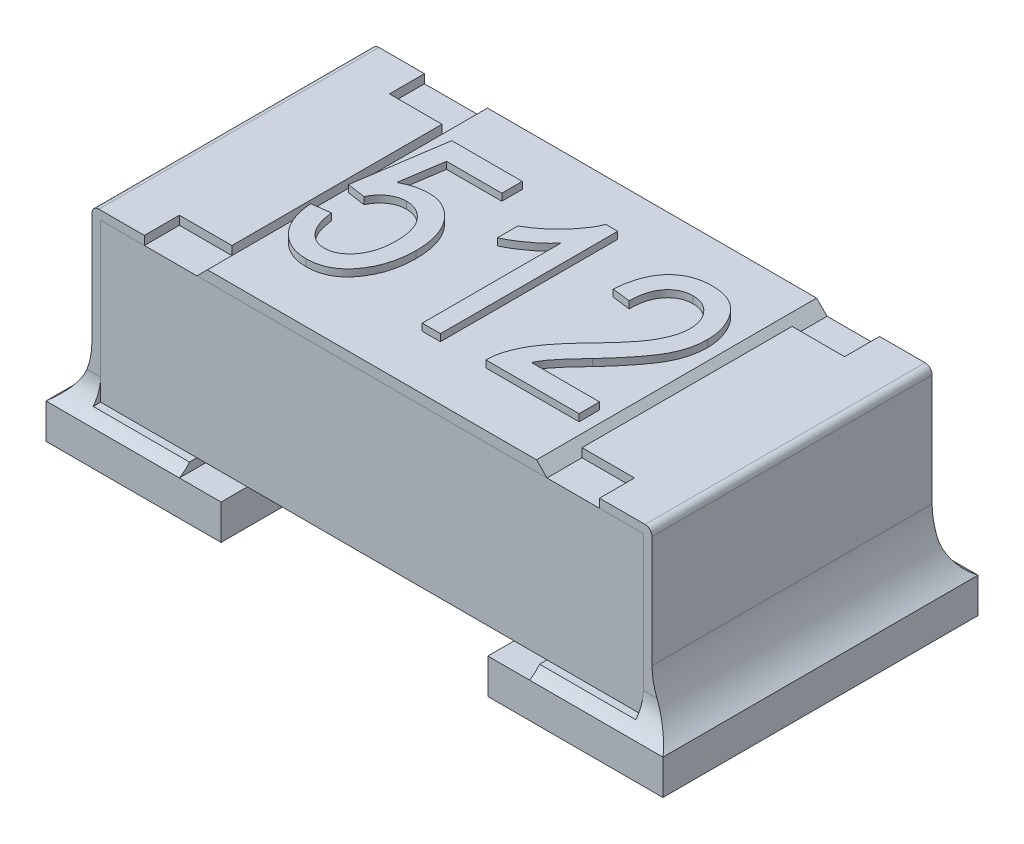
from build123d import *

# Parameters (mm, degrees)
SKETCH1_W             = 0.8
SKETCH1_H             = 0.45
BOSS_EXTRUDE1_DEPTH   = 0.775
BOSS_EXTRUDE2_DEPTH   = 0.4
BOSS_EXTRUDE2_2_DEPTH = 0.4
SKETCH3_W             = 0.15
SKETCH3_H             = 0.1
CUT_EXTRUDE1_DEPTH    = 0.025
BOSS_EXTRUDE3_DEPTH   = 0.4
SKETCH7_W             = 0.5
SKETCH7_H             = 0.9
BOSS_EXTRUDE5_DEPTH   = 0.1
FILLET3_R             = 0.2
FILLET4_R             = 0.2
FILLET5_R             = 0.1
FILLET6_R             = 0.1
BOSS_EXTRU_1_DEPTH    = 0.02


with BuildPart() as part:
    # Sketch1 → Boss-Extrude1 (new, symmetric)
    with BuildSketch(Plane(origin=(0, 0, 0), x_dir=(0, 0, -1), z_dir=(1, 0, 0))):
        with Locations((0, 0.35)):
            Rectangle(SKETCH1_W, SKETCH1_H)
    extrude(amount=BOSS_EXTRUDE1_DEPTH, both=True)


with BuildPart() as body_2:
    # Sketch2 → Boss-Extrude2 (new, symmetric)
    with BuildSketch(Plane.XY):
        with BuildLine():
            Line((-0.5, 0.6), (-0.78, 0.6))
            ThreePointArc((-0.78, 0.6), (-0.794142136, 0.594142136), (-0.8, 0.58))
            Line((-0.8, 0.58), (-0.8, 0.1))
            Line((-0.8, 0.1), (-0.5, 0.1))
            Line((-0.5, 0.1), (-0.5, 0.125))
            Line((-0.5, 0.125), (-0.775, 0.125))
            Line((-0.775, 0.125), (-0.775, 0.575))
            Line((-0.775, 0.575), (-0.5, 0.575))
            Line((-0.5, 0.575), (-0.5, 0.6))
        make_face()
    extrude(amount=BOSS_EXTRUDE2_DEPTH, both=True)


with BuildPart() as body_3:
    # Sketch2 → Boss-Extrude2 2 (new, symmetric)
    with BuildSketch(Plane.XY):
        with BuildLine():
            Line((0.5, 0.575), (0.5, 0.6))
            Line((0.5, 0.6), (0.78, 0.6))
            ThreePointArc((0.78, 0.6), (0.794142136, 0.594142136), (0.8, 0.58))
            Line((0.8, 0.58), (0.8, 0.1))
            Line((0.8, 0.1), (0.5, 0.1))
            Line((0.5, 0.1), (0.5, 0.125))
            Line((0.5, 0.125), (0.775, 0.125))
            Line((0.775, 0.125), (0.775, 0.575))
            Line((0.775, 0.575), (0.5, 0.575))
        make_face()
    extrude(amount=BOSS_EXTRUDE2_2_DEPTH, both=True)


with BuildPart() as cut_extrude1_tool:
    # Sketch3 → Cut-Extrude1 (new body)
    with BuildSketch(Plane(origin=(0, 0.6, 0), x_dir=(1, 0, 0), z_dir=(0, 1, 0))):
        with Locations((-0.575, 0.35)):
            Rectangle(SKETCH3_W, SKETCH3_H)
        with Locations((-0.575, -0.35)):
            Rectangle(SKETCH3_W, SKETCH3_H)
        with Locations((0.575, -0.35)):
            Rectangle(SKETCH3_W, SKETCH3_H)
        with Locations((0.575, 0.35)):
            Rectangle(SKETCH3_W, SKETCH3_H)
    extrude(amount=-CUT_EXTRUDE1_DEPTH)


with BuildPart() as body_2_1:
    add(body_2.part)

    # Cut-Extrude1: cut by cut_extrude1_tool
    add(cut_extrude1_tool.part, mode=Mode.SUBTRACT)



with BuildPart() as body_3_1:
    add(body_3.part)

    # Cut-Extrude1: cut by cut_extrude1_tool
    add(cut_extrude1_tool.part, mode=Mode.SUBTRACT)


with BuildPart() as body_4:
    # Sketch4 → Boss-Extrude3 (new, symmetric)
    with BuildSketch(Plane.XY):
        Polygon((-0.5, 0.575), (0.5, 0.575), (0.47, 0.605), (-0.47, 0.605), align=None)
    extrude(amount=BOSS_EXTRUDE3_DEPTH, both=True)

    # Esquisse2 → Boss.-Extru.1 (add)
    with BuildSketch(Plane(origin=(0, 0.605, 0), x_dir=(1, 0, 0), z_dir=(0, 1, 0))):
        with BuildLine():
            Line((-0.465730847, -0.108858251), (-0.413782795, -0.102364745))
            add(Edge.make_bspline(
                [(-0.413782795, -0.102364745), (-0.413255524, -0.10632978), (-0.412227963, -0.114056947), (-0.409939613, -0.125180568), (-0.407415582, -0.135603594), (-0.404045523, -0.145121264), (-0.400626665, -0.15403946), (-0.39640024, -0.162029886), (-0.391876466, -0.16932883), (-0.386736053, -0.175698484), (-0.381397823, -0.18142979), (-0.375711396, -0.186278974), (-0.369825621, -0.190408468), (-0.363777606, -0.193881278), (-0.357441181, -0.196550033), (-0.350887972, -0.198356382), (-0.344153896, -0.199519336), (-0.339585693, -0.199684182), (-0.337281172, -0.199767342)],
                knots=[0, 0, 0, 0, 1.411223046, 2.750228965, 4.006672634, 5.191927097, 6.311278306, 7.373684419, 8.377051755, 9.337097037, 10.257438676, 11.13782359, 11.969011532, 12.792190119, 13.594685164, 14.388253401, 15.186922146, 16, 16, 16, 16], degree=3))
            add(Edge.make_bspline(
                [(-0.337281172, -0.199767342), (-0.334399224, -0.19967312), (-0.328695787, -0.199486653), (-0.320314285, -0.197896056), (-0.312204618, -0.195385374), (-0.304491542, -0.191645293), (-0.297016322, -0.187062547), (-0.289850449, -0.181427485), (-0.283106071, -0.174677868), (-0.276607435, -0.167084798), (-0.270594479, -0.158633772), (-0.265572152, -0.149201961), (-0.261205023, -0.139122381), (-0.257493108, -0.128326585), (-0.254811701, -0.116723177), (-0.252928835, -0.104408294), (-0.251652717, -0.091365789), (-0.251515622, -0.082413923), (-0.251445133, -0.077811173)],
                knots=[0, 0, 0, 0, 0.833557162, 1.649627401, 2.46080936, 3.284070299, 4.12358479, 4.995082037, 5.915776015, 6.88098611, 7.885890802, 8.910954604, 9.967600199, 11.063514457, 12.210406555, 13.409466691, 14.668034258, 16, 16, 16, 16], degree=3))
            add(Edge.make_bspline(
                [(-0.251445133, -0.077811173), (-0.251525537, -0.073513326), (-0.251682195, -0.065139515), (-0.252825083, -0.052939695), (-0.254589824, -0.041462371), (-0.257218974, -0.030723767), (-0.260722603, -0.020784801), (-0.264707181, -0.011475116), (-0.269628483, -0.002972401), (-0.275322452, 0.004679943), (-0.281449103, 0.011603699), (-0.28813801, 0.017531924), (-0.295128248, 0.022608714), (-0.302491246, 0.026895947), (-0.310366213, 0.029947793), (-0.318522371, 0.032383742), (-0.327129264, 0.033661243), (-0.332982468, 0.033884989), (-0.335962178, 0.033998892)],
                knots=[0, 0, 0, 0, 1.312040837, 2.556345105, 3.737883698, 4.854849349, 5.925960309, 6.952388988, 7.9424386, 8.917239489, 9.860521384, 10.760061641, 11.639947922, 12.495504232, 13.352616949, 14.212152034, 15.089854369, 16, 16, 16, 16], degree=3))
            add(Edge.make_bspline(
                [(-0.335962178, 0.033998892), (-0.339560256, 0.033842484), (-0.346738056, 0.033530467), (-0.3573376, 0.031001936), (-0.36751786, 0.026769375), (-0.377256234, 0.021085604), (-0.386316456, 0.013991919), (-0.394372864, 0.005430954), (-0.401556662, -0.004326519), (-0.405353676, -0.011602222), (-0.407289289, -0.015311173)],
                knots=[0, 0, 0, 0, 0.943378558, 1.881944462, 2.841095037, 3.827409543, 4.832274565, 5.849176661, 6.903569879, 8, 8, 8, 8], degree=3))
            Line((-0.407289289, -0.015311173), (-0.459237341, -0.007904517))
            Line((-0.459237341, -0.007904517), (-0.420276302, 0.248284606))
            Line((-0.420276302, 0.248284606), (-0.2189776, 0.248284606))
            Line((-0.2189776, 0.248284606), (-0.2189776, 0.189843048))
            Line((-0.2189776, 0.189843048), (-0.376749516, 0.189843048))
            Line((-0.376749516, 0.189843048), (-0.395519808, 0.066364963))
            add(Edge.make_bspline(
                [(-0.395519808, 0.066364963), (-0.389667734, 0.069357763), (-0.378086004, 0.075280756), (-0.35965791, 0.081449164), (-0.340719567, 0.085255659), (-0.327896886, 0.085715743), (-0.32145325, 0.085946944)],
                knots=[0, 0, 0, 0, 1.017619267, 2.013951072, 3.001973272, 4, 4, 4, 4], degree=3))
            add(Edge.make_bspline(
                [(-0.32145325, 0.085946944), (-0.317420084, 0.085804728), (-0.309404308, 0.085522079), (-0.297621278, 0.083433619), (-0.286225968, 0.080090546), (-0.275271508, 0.075240494), (-0.264752158, 0.069033879), (-0.254589199, 0.061518965), (-0.244831823, 0.052681912), (-0.235688002, 0.042434726), (-0.227165164, 0.031161808), (-0.219724252, 0.018784706), (-0.21340909, 0.005470627), (-0.208397971, -0.00884409), (-0.204270056, -0.024015033), (-0.20148233, -0.040184073), (-0.199879561, -0.057283387), (-0.199626608, -0.068980601), (-0.199497081, -0.074970264)],
                knots=[0, 0, 0, 0, 0.861018809, 1.711245113, 2.547675859, 3.391805506, 4.262674834, 5.151129072, 6.086914488, 7.068866089, 8.080081396, 9.100796714, 10.1476286, 11.221399762, 12.335728169, 13.501851446, 14.720800604, 16, 16, 16, 16], degree=3))
            add(Edge.make_bspline(
                [(-0.199497081, -0.074970264), (-0.199620584, -0.080926474), (-0.199863906, -0.092661178), (-0.20158944, -0.109929655), (-0.204551075, -0.12653937), (-0.208613835, -0.142513503), (-0.21375326, -0.157880806), (-0.220191737, -0.172572219), (-0.227820461, -0.186572985), (-0.236470897, -0.19982956), (-0.246114354, -0.211927399), (-0.256609096, -0.222645765), (-0.268035786, -0.23158885), (-0.280207571, -0.238999073), (-0.293207827, -0.244721933), (-0.307016835, -0.24877331), (-0.321633005, -0.251276091), (-0.331656844, -0.251566927), (-0.336773867, -0.251715394)],
                knots=[0, 0, 0, 0, 1.144340564, 2.254537473, 3.330370625, 4.383172833, 5.418849903, 6.440219285, 7.460844228, 8.47914966, 9.47775429, 10.428908251, 11.354479858, 12.258284926, 13.160219244, 14.07516849, 15.0174017, 16, 16, 16, 16], degree=3))
            add(Edge.make_bspline(
                [(-0.336773867, -0.251715394), (-0.34104083, -0.251593199), (-0.349440992, -0.25135264), (-0.361789337, -0.249605729), (-0.373627784, -0.246662656), (-0.384963848, -0.242485809), (-0.39574724, -0.237052476), (-0.406080895, -0.230538739), (-0.415818194, -0.222757814), (-0.425071448, -0.21394225), (-0.433573852, -0.204043349), (-0.441094734, -0.193094004), (-0.447723688, -0.181293636), (-0.453310482, -0.168544746), (-0.45783428, -0.154904865), (-0.461493302, -0.140393206), (-0.464274577, -0.124970913), (-0.465237794, -0.114313555), (-0.465730847, -0.108858251)],
                knots=[0, 0, 0, 0, 0.958587677, 1.88712499, 2.795765124, 3.694982091, 4.595578744, 5.504218877, 6.434682167, 7.391400486, 8.372260331, 9.360890354, 10.371359061, 11.409147611, 12.483330096, 13.596558593, 14.769722824, 16, 16, 16, 16], degree=3))
        make_face()
        with BuildLine():
            Line((0.040762659, -0.245221888), (-0.011185393, -0.245221888))
            Line((-0.011185393, -0.245221888), (-0.011185393, 0.150882009))
            add(Edge.make_bspline(
                [(-0.011185393, 0.150882009), (-0.014375712, 0.147209677), (-0.020987646, 0.139598774), (-0.032465624, 0.128775009), (-0.045256563, 0.1176135), (-0.05941783, 0.106782892), (-0.073847034, 0.096408923), (-0.088098555, 0.087284837), (-0.101638251, 0.079346193), (-0.110721477, 0.075031174), (-0.115081496, 0.072959931)],
                knots=[0, 0, 0, 0, 0.892555828, 1.849821039, 2.893015883, 4.008277588, 5.121255548, 6.154629642, 7.114207698, 8, 8, 8, 8], degree=3))
            Line((-0.115081496, 0.072959931), (-0.115081496, 0.131401489))
            add(Edge.make_bspline(
                [(-0.115081496, 0.131401489), (-0.108074593, 0.13561851), (-0.094120785, 0.144016443), (-0.074569673, 0.158564375), (-0.056099991, 0.174266475), (-0.039263792, 0.191287267), (-0.024188824, 0.208833156), (-0.011249633, 0.226343975), (-0.000640316, 0.243633673), (0.004563893, 0.255526991), (0.007077594, 0.261271619)],
                knots=[0, 0, 0, 0, 1.082272232, 2.155277244, 3.222407096, 4.289527553, 5.32168536, 6.282742408, 7.170542132, 8, 8, 8, 8], degree=3))
            Line((0.007077594, 0.261271619), (0.040762659, 0.261271619))
            Line((0.040762659, 0.261271619), (0.040762659, -0.245221888))
        make_face()
        with BuildLine():
            Line((0.436866556, -0.186780329), (0.436866556, -0.245221888))
            Line((0.436866556, -0.245221888), (0.170632789, -0.245221888))
            add(Edge.make_bspline(
                [(0.170632789, -0.245221888), (0.170620463, -0.242176838), (0.170595488, -0.236007517), (0.171425805, -0.226601844), (0.173131761, -0.216968453), (0.175310093, -0.206978835), (0.17839873, -0.196764374), (0.182179794, -0.186275439), (0.186641118, -0.175538143), (0.191864922, -0.164488895), (0.197969199, -0.153021711), (0.205335292, -0.141184566), (0.213800759, -0.128765128), (0.223376797, -0.115839112), (0.234250689, -0.102529104), (0.246099687, -0.088637518), (0.259092893, -0.074193289), (0.268344083, -0.064593521), (0.273108439, -0.059649647)],
                knots=[0, 0, 0, 0, 0.672188691, 1.361865275, 2.08134618, 2.831455259, 3.618325166, 4.435686407, 5.292818481, 6.184803937, 7.133719261, 8.159707436, 9.261705982, 10.452168352, 11.710682541, 13.056179633, 14.483934645, 16, 16, 16, 16], degree=3))
            add(Edge.make_bspline(
                [(0.273108439, -0.059649647), (0.278645154, -0.053922862), (0.28930567, -0.042896383), (0.304309328, -0.026615111), (0.317941658, -0.011481871), (0.329930295, 0.002776991), (0.340488081, 0.015967273), (0.349721239, 0.028070116), (0.357188517, 0.039360185), (0.365251054, 0.052644574), (0.372937537, 0.068459429), (0.379732824, 0.086894144), (0.384123449, 0.104715028), (0.384658645, 0.116463957), (0.384918504, 0.122168535)],
                knots=[0, 0, 0, 0, 1.312560889, 2.527233899, 3.64818266, 4.668586789, 5.596397896, 6.432357998, 7.175835261, 7.825761013, 8.992224112, 10.065918602, 11.060925749, 12, 12, 12, 12], degree=3))
            add(Edge.make_bspline(
                [(0.384918504, 0.122168535), (0.38488227, 0.125317915), (0.384811501, 0.131468985), (0.383608892, 0.140451965), (0.381893813, 0.14899617), (0.3796294, 0.157163351), (0.376418723, 0.164819361), (0.372571791, 0.172017316), (0.368065657, 0.178789817), (0.362923472, 0.185037408), (0.357252813, 0.190673516), (0.351276734, 0.195736851), (0.344839772, 0.199834879), (0.338206488, 0.203402296), (0.33115273, 0.205987741), (0.323827032, 0.207958519), (0.316161618, 0.209069733), (0.310956748, 0.209238117), (0.308315419, 0.209323567)],
                knots=[0, 0, 0, 0, 1.164486654, 2.274364258, 3.346924328, 4.388668322, 5.404300818, 6.412115579, 7.404820287, 8.409522099, 9.400647826, 10.360464378, 11.301161788, 12.219192522, 13.141987859, 14.073903283, 15.022558797, 16, 16, 16, 16], degree=3))
            add(Edge.make_bspline(
                [(0.308315419, 0.209323567), (0.305467549, 0.209263822), (0.299908376, 0.209147197), (0.291805518, 0.207697867), (0.284041492, 0.205758951), (0.276655696, 0.202751859), (0.269702154, 0.198899959), (0.263080695, 0.194263463), (0.256920928, 0.188754733), (0.251098767, 0.182490648), (0.245994902, 0.175347606), (0.241308805, 0.167618053), (0.237618701, 0.158974566), (0.234481048, 0.149683668), (0.232023772, 0.139637057), (0.230381279, 0.128872622), (0.229176758, 0.117392989), (0.229109112, 0.109489326), (0.229074348, 0.105427463)],
                knots=[0, 0, 0, 0, 0.928788257, 1.813037313, 2.680996359, 3.53827917, 4.408273621, 5.272359245, 6.172129225, 7.102295458, 8.058839945, 9.034325244, 10.048074492, 11.120300332, 12.234644845, 13.420320921, 14.674247329, 16, 16, 16, 16], degree=3))
            Line((0.229074348, 0.105427463), (0.177126296, 0.11192097))
            add(Edge.make_bspline(
                [(0.177126296, 0.11192097), (0.177661646, 0.117949128), (0.178700249, 0.129644029), (0.181425255, 0.146574214), (0.185206691, 0.162282392), (0.189695492, 0.176925272), (0.195342921, 0.190321129), (0.201656925, 0.202713751), (0.209140532, 0.213833745), (0.217485989, 0.223818585), (0.226623406, 0.232677174), (0.236501282, 0.24032371), (0.247106206, 0.246769595), (0.258317066, 0.252189545), (0.270365598, 0.256236922), (0.283035651, 0.259174418), (0.296430274, 0.260914731), (0.305570867, 0.261150899), (0.310243179, 0.261271619)],
                knots=[0, 0, 0, 0, 1.296155121, 2.514599762, 3.669097984, 4.755193195, 5.79120272, 6.77953026, 7.729955905, 8.65570694, 9.562583864, 10.450894749, 11.325630111, 12.216772649, 13.112585423, 14.04224033, 14.999270054, 16, 16, 16, 16], degree=3))
            add(Edge.make_bspline(
                [(0.310243179, 0.261271619), (0.315287924, 0.261123536), (0.325110881, 0.260835194), (0.339410791, 0.258935248), (0.352748071, 0.255583871), (0.365182294, 0.250920378), (0.376564128, 0.244781019), (0.387078711, 0.237416689), (0.396550564, 0.228603521), (0.404979649, 0.21857538), (0.412428841, 0.207748797), (0.418928747, 0.196427916), (0.424566895, 0.18480032), (0.428973266, 0.172736626), (0.432653055, 0.16039874), (0.434964779, 0.147599635), (0.436592216, 0.134486989), (0.436774592, 0.125623379), (0.436866556, 0.121153924)],
                knots=[0, 0, 0, 0, 1.141256367, 2.222215694, 3.255808886, 4.246221905, 5.218350639, 6.173592628, 7.142736081, 8.136099926, 9.131465336, 10.11177911, 11.087094076, 12.050634184, 13.014356534, 13.995714735, 14.989343724, 16, 16, 16, 16], degree=3))
            add(Edge.make_bspline(
                [(0.436866556, 0.121153924), (0.436779909, 0.117127141), (0.436607744, 0.109126037), (0.4354878, 0.097187936), (0.43351089, 0.085410333), (0.43094396, 0.073679984), (0.427301469, 0.062178516), (0.423177974, 0.050723257), (0.418176495, 0.039443439), (0.412272125, 0.028118881), (0.405358874, 0.016348836), (0.397074513, 0.003918486), (0.387572676, -0.009504436), (0.376467413, -0.023680764), (0.364296829, -0.039018169), (0.350523248, -0.055130192), (0.335415402, -0.072158915), (0.324771484, -0.083713449), (0.319273211, -0.089682115)],
                knots=[0, 0, 0, 0, 0.78053567, 1.550902233, 2.321464013, 3.094364546, 3.87611052, 4.657966429, 5.453363508, 6.265521698, 7.132350641, 8.097801917, 9.160103787, 10.319208993, 11.587678713, 12.955014444, 14.427067756, 16, 16, 16, 16], degree=3))
            add(Edge.make_bspline(
                [(0.319273211, -0.089682115), (0.31578272, -0.093395828), (0.30911211, -0.100493032), (0.299665728, -0.110762774), (0.291188926, -0.120105032), (0.28349715, -0.128388282), (0.276970664, -0.135891091), (0.271312279, -0.142415262), (0.266688943, -0.148041211), (0.259760015, -0.156885556), (0.251020841, -0.169347157), (0.244983139, -0.181095194), (0.242061361, -0.186780329)],
                knots=[0, 0, 0, 0, 1.227496676, 2.345844757, 3.360613726, 4.265798447, 5.068085109, 5.75545707, 6.345771879, 6.821573405, 8.46188917, 10, 10, 10, 10], degree=3))
            Line((0.242061361, -0.186780329), (0.436866556, -0.186780329))
        make_face()
    extrude(amount=BOSS_EXTRU_1_DEPTH)


with BuildPart() as body_2_2:
    add(body_2_1.part)

    add(body_3_1.part)  # Boss-Extrude5 merges body 3
    # Sketch7 → Boss-Extrude5 (add)
    with BuildSketch(Plane(origin=(0, 0, 0), x_dir=(1, 0, 0), z_dir=(0, 1, 0))):
        with Locations((-0.631, 0)):
            Rectangle(SKETCH7_W, SKETCH7_H)
        with Locations((0.631, 0)):
            Rectangle(SKETCH7_W, SKETCH7_H)
    extrude(amount=BOSS_EXTRUDE5_DEPTH)

    # Fillet3
    # the kernel refuses this fillet: 0.2 mm, written as the material it adds along each edge
    with BuildSketch(Plane(origin=(-0.8, 0.1, -0.4), x_dir=(-1.0, 1.981473969784949e-11, 0), z_dir=(0, 0, 1))) as fillet3_piece_1:
        with BuildLine():
            CenterArc((0.2, -0.16074514), FILLET3_R, 126.5126321, 53.487367901)
            Line((0, -0.16074514), (-0.004, -0.16074514))
            Line((-0.004, -0.16074514), (-0.004, 0))
            Line((-0.004, 0), (0, 0.004))
            ThreePointArc((0, 0.004), (0.0405, 0.004), (0.07862, 0.003214903))
            Line((0.07862, 0.003214903), (0.081, 0))
        make_face()
    extrude(amount=0.8)

    # Fillet4
    # the kernel refuses this fillet: 0.2 mm, written as the material it adds along each edge
    with BuildSketch(Plane(origin=(0.8, 0.1, 0.4), x_dir=(1.0, 1.981542502070424e-11, 0), z_dir=(0, 0, -1))) as fillet4_piece_1:
        with BuildLine():
            CenterArc((0.2, -0.16074514), FILLET4_R, 126.5126321, 53.487367901)
            Line((0, -0.16074514), (-0.004, -0.16074514))
            Line((-0.004, -0.16074514), (-0.004, 0))
            Line((-0.004, 0), (0, 0.004))
            ThreePointArc((0, 0.004), (0.0405, 0.004), (0.07862, 0.003214903))
            Line((0.07862, 0.003214903), (0.081, 0))
        make_face()
    extrude(amount=0.8)

    # Fillet5
    # the kernel refuses this fillet: 0.1 mm, written as the material it adds along each edge
    with BuildSketch(Plane(origin=(0.5, 0.1, 0.4), x_dir=(0, -1.6392998070069752e-11, 1.0), z_dir=(1.0, 4.321346430286522e-12, 0))) as fillet5_piece_1_section:
        with BuildLine():
            CenterArc((0.1, -0.08660254), FILLET5_R, 119.999999999, 60)
            Line((0, -0.08660254), (-0.002, -0.08660254))
            Line((-0.002, -0.08660254), (-0.002, 0))
            Line((-0.002, 0), (0, 0.002))
            ThreePointArc((0, 0.002), (0.025, 0.002), (0.049, 0.001732051))
            Line((0.049, 0.001732051), (0.05, 0))
        make_face()
    fillet5_piece_1 = extrude(amount=0.381, mode=Mode.PRIVATE)
    fillet5_piece_1 = split(fillet5_piece_1, bisect_by=Plane(origin=(0.5, 0.125, 0.4), z_dir=(0, -1, 0)), keep=Keep.TOP, mode=Mode.PRIVATE)
    fillet5_piece_1 = split(fillet5_piece_1, bisect_by=Plane(origin=(0.775, 0.1, 0.4), z_dir=(-1, 0, 0)), keep=Keep.TOP, mode=Mode.PRIVATE)
    add(fillet5_piece_1)
    with BuildSketch(Plane(origin=(0.5, 0.1, 0.4), x_dir=(0, -1.6392998070069752e-11, 1.0), z_dir=(1.0, 4.321346430286522e-12, 0))) as fillet5_piece_2_section:
        with BuildLine():
            CenterArc((0.1, -0.08660254), FILLET5_R, 119.999999999, 60)
            Line((0, -0.08660254), (-0.002, -0.08660254))
            Line((-0.002, -0.08660254), (-0.002, 0))
            Line((-0.002, 0), (0, 0.002))
            ThreePointArc((0, 0.002), (0.025, 0.002), (0.049, 0.001732051))
            Line((0.049, 0.001732051), (0.05, 0))
        make_face()
    fillet5_piece_2 = extrude(amount=0.381, mode=Mode.PRIVATE)
    fillet5_piece_2 = fillet5_piece_2 - Plane(origin=(1, 0.26074514, 0.4), x_dir=(1.0, 2e-11, 0), z_dir=(0, 0, 1)) * Cylinder(0.2, 2, mode=Mode.PRIVATE)
    fillet5_piece_2 = split(fillet5_piece_2, bisect_by=Plane(origin=(0.5, 0.125, 0.4), z_dir=(0, -1, 0)), keep=Keep.TOP, mode=Mode.PRIVATE)
    fillet5_piece_2 = split(fillet5_piece_2, bisect_by=Plane(origin=(0.775, 0.1, 0.4), z_dir=(1, 0, 0)), keep=Keep.TOP, mode=Mode.PRIVATE)
    add(fillet5_piece_2)
    with BuildSketch(Plane(origin=(0.5, 0.1, 0.4), x_dir=(0, -1.6392998070069752e-11, 1.0), z_dir=(1.0, 4.321346430286522e-12, 0))) as fillet5_piece_3_section:
        with BuildLine():
            CenterArc((0.1, -0.08660254), FILLET5_R, 119.999999999, 60)
            Line((0, -0.08660254), (-0.002, -0.08660254))
            Line((-0.002, -0.08660254), (-0.002, 0))
            Line((-0.002, 0), (0, 0.002))
            ThreePointArc((0, 0.002), (0.025, 0.002), (0.049, 0.001732051))
            Line((0.049, 0.001732051), (0.05, 0))
        make_face()
    fillet5_piece_3 = extrude(amount=0.381, mode=Mode.PRIVATE)
    fillet5_piece_3 = fillet5_piece_3 - Plane(origin=(1, 0.26074514, 0.4), x_dir=(1.0, 2e-11, 0), z_dir=(0, 0, 1)) * Cylinder(0.2, 2, mode=Mode.PRIVATE)
    fillet5_piece_3 = split(fillet5_piece_3, bisect_by=Plane(origin=(0.5, 0.125, 0.4), z_dir=(0, 1, 0)), keep=Keep.TOP, mode=Mode.PRIVATE)
    fillet5_piece_3 = split(fillet5_piece_3, bisect_by=Plane(origin=(0.775, 0.1, 0.4), z_dir=(1, 0, 0)), keep=Keep.TOP, mode=Mode.PRIVATE)
    add(fillet5_piece_3)
    # the kernel refuses this fillet: 0.1 mm, written as the material it adds along each edge
    with BuildSketch(Plane(origin=(0.881, 0.1, -0.4), x_dir=(0, -1.639244295855736e-11, -1.0), z_dir=(-1.0, -4.321346430286522e-12, 0))) as fillet5_2_piece_1_section:
        with BuildLine():
            CenterArc((0.1, -0.08660254), FILLET5_R, 119.999999999, 60)
            Line((0, -0.08660254), (-0.002, -0.08660254))
            Line((-0.002, -0.08660254), (-0.002, 0))
            Line((-0.002, 0), (0, 0.002))
            ThreePointArc((0, 0.002), (0.025, 0.002), (0.049, 0.001732051))
            Line((0.049, 0.001732051), (0.05, 0))
        make_face()
    fillet5_2_piece_1 = extrude(amount=0.381, mode=Mode.PRIVATE)
    fillet5_2_piece_1 = fillet5_2_piece_1 - Plane(origin=(1, 0.26074514, -0.4), x_dir=(1.0, 2e-11, 0), z_dir=(0, 0, 1)) * Cylinder(0.2, 2, mode=Mode.PRIVATE)
    fillet5_2_piece_1 = split(fillet5_2_piece_1, bisect_by=Plane(origin=(0.881, 0.125, -0.4), z_dir=(0, -1, 0)), keep=Keep.TOP, mode=Mode.PRIVATE)
    fillet5_2_piece_1 = split(fillet5_2_piece_1, bisect_by=Plane(origin=(0.775, 0.1, -0.4), z_dir=(1, 0, 0)), keep=Keep.TOP, mode=Mode.PRIVATE)
    add(fillet5_2_piece_1)
    with BuildSketch(Plane(origin=(0.881, 0.1, -0.4), x_dir=(0, -1.639244295855736e-11, -1.0), z_dir=(-1.0, -4.321346430286522e-12, 0))) as fillet5_2_piece_2_section:
        with BuildLine():
            CenterArc((0.1, -0.08660254), FILLET5_R, 119.999999999, 60)
            Line((0, -0.08660254), (-0.002, -0.08660254))
            Line((-0.002, -0.08660254), (-0.002, 0))
            Line((-0.002, 0), (0, 0.002))
            ThreePointArc((0, 0.002), (0.025, 0.002), (0.049, 0.001732051))
            Line((0.049, 0.001732051), (0.05, 0))
        make_face()
    fillet5_2_piece_2 = extrude(amount=0.381, mode=Mode.PRIVATE)
    fillet5_2_piece_2 = fillet5_2_piece_2 - Plane(origin=(1, 0.26074514, -0.4), x_dir=(1.0, 2e-11, 0), z_dir=(0, 0, 1)) * Cylinder(0.2, 2, mode=Mode.PRIVATE)
    fillet5_2_piece_2 = split(fillet5_2_piece_2, bisect_by=Plane(origin=(0.881, 0.125, -0.4), z_dir=(0, 1, 0)), keep=Keep.TOP, mode=Mode.PRIVATE)
    fillet5_2_piece_2 = split(fillet5_2_piece_2, bisect_by=Plane(origin=(0.775, 0.1, -0.4), z_dir=(1, 0, 0)), keep=Keep.TOP, mode=Mode.PRIVATE)
    add(fillet5_2_piece_2)
    with BuildSketch(Plane(origin=(0.881, 0.1, -0.4), x_dir=(0, -1.639244295855736e-11, -1.0), z_dir=(-1.0, -4.321346430286522e-12, 0))) as fillet5_2_piece_3_section:
        with BuildLine():
            CenterArc((0.1, -0.08660254), FILLET5_R, 119.999999999, 60)
            Line((0, -0.08660254), (-0.002, -0.08660254))
            Line((-0.002, -0.08660254), (-0.002, 0))
            Line((-0.002, 0), (0, 0.002))
            ThreePointArc((0, 0.002), (0.025, 0.002), (0.049, 0.001732051))
            Line((0.049, 0.001732051), (0.05, 0))
        make_face()
    fillet5_2_piece_3 = extrude(amount=0.381, mode=Mode.PRIVATE)
    fillet5_2_piece_3 = split(fillet5_2_piece_3, bisect_by=Plane(origin=(0.881, 0.125, -0.4), z_dir=(0, -1, 0)), keep=Keep.TOP, mode=Mode.PRIVATE)
    fillet5_2_piece_3 = split(fillet5_2_piece_3, bisect_by=Plane(origin=(0.775, 0.1, -0.4), z_dir=(-1, 0, 0)), keep=Keep.TOP, mode=Mode.PRIVATE)
    add(fillet5_2_piece_3)

    # Fillet6
    # the kernel refuses this fillet: 0.1 mm, written as the material it adds along each edge
    with BuildSketch(Plane(origin=(-0.5, 0.1, -0.4), x_dir=(0, -1.6393275625825854e-11, -1.0), z_dir=(-1.0, 4.321237156366773e-12, 0))) as fillet6_piece_1_section:
        with BuildLine():
            CenterArc((0.1, -0.08660254), FILLET6_R, 119.999999999, 60)
            Line((0, -0.08660254), (-0.002, -0.08660254))
            Line((-0.002, -0.08660254), (-0.002, 0))
            Line((-0.002, 0), (0, 0.002))
            ThreePointArc((0, 0.002), (0.025, 0.002), (0.049, 0.001732051))
            Line((0.049, 0.001732051), (0.05, 0))
        make_face()
    fillet6_piece_1 = extrude(amount=0.381, mode=Mode.PRIVATE)
    fillet6_piece_1 = split(fillet6_piece_1, bisect_by=Plane(origin=(-0.5, 0.125, -0.4), z_dir=(0, -1, 0)), keep=Keep.TOP, mode=Mode.PRIVATE)
    fillet6_piece_1 = split(fillet6_piece_1, bisect_by=Plane(origin=(-0.775, 0.1, -0.4), z_dir=(1, 0, 0)), keep=Keep.TOP, mode=Mode.PRIVATE)
    add(fillet6_piece_1)
    with BuildSketch(Plane(origin=(-0.5, 0.1, -0.4), x_dir=(0, -1.6393275625825854e-11, -1.0), z_dir=(-1.0, 4.321237156366773e-12, 0))) as fillet6_piece_2_section:
        with BuildLine():
            CenterArc((0.1, -0.08660254), FILLET6_R, 119.999999999, 60)
            Line((0, -0.08660254), (-0.002, -0.08660254))
            Line((-0.002, -0.08660254), (-0.002, 0))
            Line((-0.002, 0), (0, 0.002))
            ThreePointArc((0, 0.002), (0.025, 0.002), (0.049, 0.001732051))
            Line((0.049, 0.001732051), (0.05, 0))
        make_face()
    fillet6_piece_2 = extrude(amount=0.381, mode=Mode.PRIVATE)
    fillet6_piece_2 = fillet6_piece_2 - Plane(origin=(-1, 0.26074514, -0.4), x_dir=(-1.0, 2e-11, 0), z_dir=(0, 0, -1)) * Cylinder(0.2, 2, mode=Mode.PRIVATE)
    fillet6_piece_2 = split(fillet6_piece_2, bisect_by=Plane(origin=(-0.5, 0.125, -0.4), z_dir=(0, -1, 0)), keep=Keep.TOP, mode=Mode.PRIVATE)
    fillet6_piece_2 = split(fillet6_piece_2, bisect_by=Plane(origin=(-0.775, 0.1, -0.4), z_dir=(-1, 0, 0)), keep=Keep.TOP, mode=Mode.PRIVATE)
    add(fillet6_piece_2)
    with BuildSketch(Plane(origin=(-0.5, 0.1, -0.4), x_dir=(0, -1.6393275625825854e-11, -1.0), z_dir=(-1.0, 4.321237156366773e-12, 0))) as fillet6_piece_3_section:
        with BuildLine():
            CenterArc((0.1, -0.08660254), FILLET6_R, 119.999999999, 60)
            Line((0, -0.08660254), (-0.002, -0.08660254))
            Line((-0.002, -0.08660254), (-0.002, 0))
            Line((-0.002, 0), (0, 0.002))
            ThreePointArc((0, 0.002), (0.025, 0.002), (0.049, 0.001732051))
            Line((0.049, 0.001732051), (0.05, 0))
        make_face()
    fillet6_piece_3 = extrude(amount=0.381, mode=Mode.PRIVATE)
    fillet6_piece_3 = fillet6_piece_3 - Plane(origin=(-1, 0.26074514, -0.4), x_dir=(-1.0, 2e-11, 0), z_dir=(0, 0, -1)) * Cylinder(0.2, 2, mode=Mode.PRIVATE)
    fillet6_piece_3 = split(fillet6_piece_3, bisect_by=Plane(origin=(-0.5, 0.125, -0.4), z_dir=(0, 1, 0)), keep=Keep.TOP, mode=Mode.PRIVATE)
    fillet6_piece_3 = split(fillet6_piece_3, bisect_by=Plane(origin=(-0.775, 0.1, -0.4), z_dir=(-1, 0, 0)), keep=Keep.TOP, mode=Mode.PRIVATE)
    add(fillet6_piece_3)
    # the kernel refuses this fillet: 0.1 mm, written as the material it adds along each edge
    with BuildSketch(Plane(origin=(-0.881, 0.1, 0.4), x_dir=(0, -1.6393830737338195e-11, 1.0), z_dir=(1.0, -4.321237156366773e-12, 0))) as fillet6_2_piece_1_section:
        with BuildLine():
            CenterArc((0.1, -0.08660254), FILLET6_R, 119.999999999, 60)
            Line((0, -0.08660254), (-0.002, -0.08660254))
            Line((-0.002, -0.08660254), (-0.002, 0))
            Line((-0.002, 0), (0, 0.002))
            ThreePointArc((0, 0.002), (0.025, 0.002), (0.049, 0.001732051))
            Line((0.049, 0.001732051), (0.05, 0))
        make_face()
    fillet6_2_piece_1 = extrude(amount=0.381, mode=Mode.PRIVATE)
    fillet6_2_piece_1 = fillet6_2_piece_1 - Plane(origin=(-1, 0.26074514, 0.4), x_dir=(-1.0, 2e-11, 0), z_dir=(0, 0, -1)) * Cylinder(0.2, 2, mode=Mode.PRIVATE)
    fillet6_2_piece_1 = split(fillet6_2_piece_1, bisect_by=Plane(origin=(-0.881, 0.125, 0.4), z_dir=(0, -1, 0)), keep=Keep.TOP, mode=Mode.PRIVATE)
    fillet6_2_piece_1 = split(fillet6_2_piece_1, bisect_by=Plane(origin=(-0.775, 0.1, 0.4), z_dir=(-1, 0, 0)), keep=Keep.TOP, mode=Mode.PRIVATE)
    add(fillet6_2_piece_1)
    with BuildSketch(Plane(origin=(-0.881, 0.1, 0.4), x_dir=(0, -1.6393830737338195e-11, 1.0), z_dir=(1.0, -4.321237156366773e-12, 0))) as fillet6_2_piece_2_section:
        with BuildLine():
            CenterArc((0.1, -0.08660254), FILLET6_R, 119.999999999, 60)
            Line((0, -0.08660254), (-0.002, -0.08660254))
            Line((-0.002, -0.08660254), (-0.002, 0))
            Line((-0.002, 0), (0, 0.002))
            ThreePointArc((0, 0.002), (0.025, 0.002), (0.049, 0.001732051))
            Line((0.049, 0.001732051), (0.05, 0))
        make_face()
    fillet6_2_piece_2 = extrude(amount=0.381, mode=Mode.PRIVATE)
    fillet6_2_piece_2 = fillet6_2_piece_2 - Plane(origin=(-1, 0.26074514, 0.4), x_dir=(-1.0, 2e-11, 0), z_dir=(0, 0, -1)) * Cylinder(0.2, 2, mode=Mode.PRIVATE)
    fillet6_2_piece_2 = split(fillet6_2_piece_2, bisect_by=Plane(origin=(-0.881, 0.125, 0.4), z_dir=(0, 1, 0)), keep=Keep.TOP, mode=Mode.PRIVATE)
    fillet6_2_piece_2 = split(fillet6_2_piece_2, bisect_by=Plane(origin=(-0.775, 0.1, 0.4), z_dir=(-1, 0, 0)), keep=Keep.TOP, mode=Mode.PRIVATE)
    add(fillet6_2_piece_2)
    with BuildSketch(Plane(origin=(-0.881, 0.1, 0.4), x_dir=(0, -1.6393830737338195e-11, 1.0), z_dir=(1.0, -4.321237156366773e-12, 0))) as fillet6_2_piece_3_section:
        with BuildLine():
            CenterArc((0.1, -0.08660254), FILLET6_R, 119.999999999, 60)
            Line((0, -0.08660254), (-0.002, -0.08660254))
            Line((-0.002, -0.08660254), (-0.002, 0))
            Line((-0.002, 0), (0, 0.002))
            ThreePointArc((0, 0.002), (0.025, 0.002), (0.049, 0.001732051))
            Line((0.049, 0.001732051), (0.05, 0))
        make_face()
    fillet6_2_piece_3 = extrude(amount=0.381, mode=Mode.PRIVATE)
    fillet6_2_piece_3 = split(fillet6_2_piece_3, bisect_by=Plane(origin=(-0.881, 0.125, 0.4), z_dir=(0, -1, 0)), keep=Keep.TOP, mode=Mode.PRIVATE)
    fillet6_2_piece_3 = split(fillet6_2_piece_3, bisect_by=Plane(origin=(-0.775, 0.1, 0.4), z_dir=(1, 0, 0)), keep=Keep.TOP, mode=Mode.PRIVATE)
    add(fillet6_2_piece_3)


solid = Compound([part.part, body_4.part, body_2_2.part])
